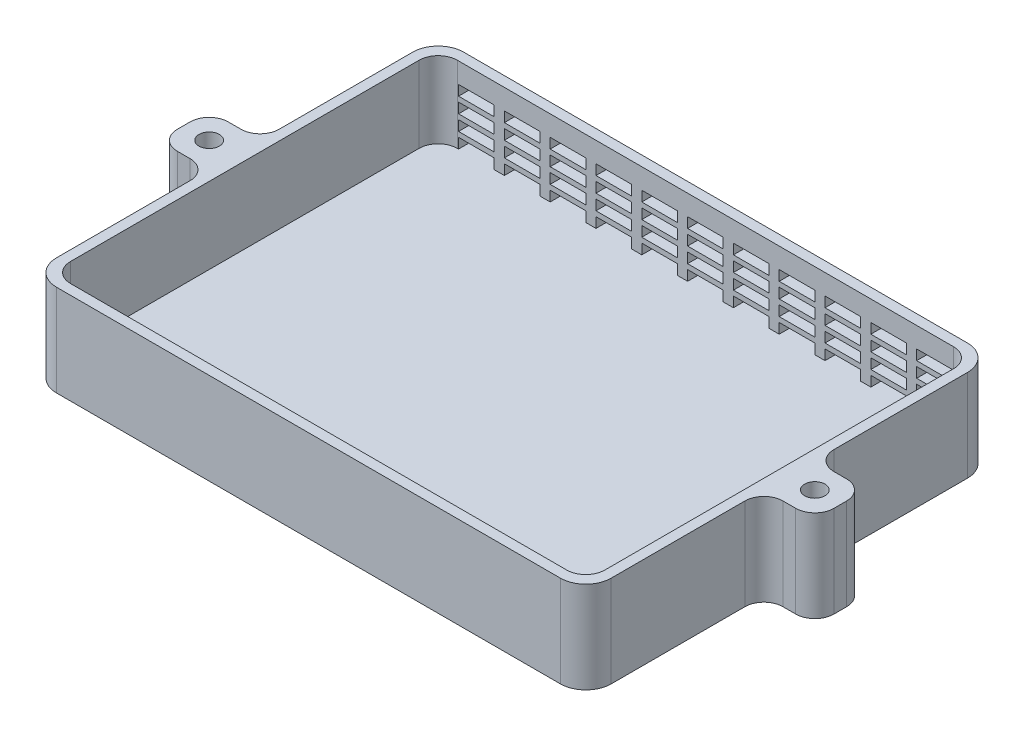
from build123d import *

# Parameters (mm, degrees)
SKETCH1_W           = 87.2
SKETCH1_H           = 64
BOSS_EXTRUDE1_DEPTH = 2.4
SKETCH2_W           = 87.2
SKETCH2_H           = 64
SKETCH2_W_2         = 84
SKETCH2_H_2         = 60.8
BOSS_EXTRUDE2_DEPTH = 12
SKETCH4_W           = 5.6
SKETCH4_H           = 1.6
CUT_EXTRUDE1_DEPTH  = 12
SKETCH7_W           = 8
SKETCH7_H           = 8
SKETCH7_R           = 1.6
BOSS_EXTRUDE4_DEPTH = 14.4
FILLET3_R           = 3
FILLET4_R           = 4
FILLET8_R           = 3
FILLET9_SIZE        = 1.6


with BuildPart() as part:
    # Sketch1 → Boss-Extrude1 (new body)
    with BuildSketch(Plane(origin=(0, 0, 0), x_dir=(1, 0, 0), z_dir=(0, 1, 0))):
        with Locations((43.6, -32)):
            Rectangle(SKETCH1_W, SKETCH1_H)
    extrude(amount=BOSS_EXTRUDE1_DEPTH)

    # Sketch2 → Boss-Extrude2 (add)
    with BuildSketch(Plane(origin=(0, 2.4, 0), x_dir=(1, 0, 0), z_dir=(0, 1, 0))):
        with Locations((43.6, -32)):
            Rectangle(SKETCH2_W, SKETCH2_H)
        with Locations((43.6, -32)):
            Rectangle(SKETCH2_W_2, SKETCH2_H_2, mode=Mode.SUBTRACT)
    extrude(amount=BOSS_EXTRUDE2_DEPTH)

    # Sketch4 → Cut-Extrude1 (cut)
    with BuildSketch(Plane(origin=(0, 0, 0), x_dir=(-1, 0, 0), z_dir=(0, 0, -1))):
        with Locations((-7.6, 3.2)):
            Rectangle(SKETCH4_W, SKETCH4_H)
        with Locations((-14.8, 3.2)):
            Rectangle(SKETCH4_W, SKETCH4_H)
        with Locations((-22, 3.2)):
            Rectangle(SKETCH4_W, SKETCH4_H)
        with Locations((-29.2, 3.2)):
            Rectangle(SKETCH4_W, SKETCH4_H)
        with Locations((-36.4, 3.2)):
            Rectangle(SKETCH4_W, SKETCH4_H)
        with Locations((-43.6, 3.2)):
            Rectangle(SKETCH4_W, SKETCH4_H)
        with Locations((-50.8, 3.2)):
            Rectangle(SKETCH4_W, SKETCH4_H)
        with Locations((-58, 3.2)):
            Rectangle(SKETCH4_W, SKETCH4_H)
        with Locations((-14.8, 5.6)):
            Rectangle(SKETCH4_W, SKETCH4_H)
        with Locations((-22, 5.6)):
            Rectangle(SKETCH4_W, SKETCH4_H)
        with Locations((-29.2, 5.6)):
            Rectangle(SKETCH4_W, SKETCH4_H)
        with Locations((-36.4, 5.6)):
            Rectangle(SKETCH4_W, SKETCH4_H)
        with Locations((-43.6, 5.6)):
            Rectangle(SKETCH4_W, SKETCH4_H)
        with Locations((-50.8, 5.6)):
            Rectangle(SKETCH4_W, SKETCH4_H)
        with Locations((-58, 5.6)):
            Rectangle(SKETCH4_W, SKETCH4_H)
        with Locations((-14.8, 8)):
            Rectangle(SKETCH4_W, SKETCH4_H)
        with Locations((-22, 8)):
            Rectangle(SKETCH4_W, SKETCH4_H)
        with Locations((-29.2, 8)):
            Rectangle(SKETCH4_W, SKETCH4_H)
        with Locations((-36.4, 8)):
            Rectangle(SKETCH4_W, SKETCH4_H)
        with Locations((-43.6, 8)):
            Rectangle(SKETCH4_W, SKETCH4_H)
        with Locations((-50.8, 8)):
            Rectangle(SKETCH4_W, SKETCH4_H)
        with Locations((-58, 8)):
            Rectangle(SKETCH4_W, SKETCH4_H)
        with Locations((-7.6, 5.6)):
            Rectangle(SKETCH4_W, SKETCH4_H)
        with Locations((-7.6, 8)):
            Rectangle(SKETCH4_W, SKETCH4_H)
        with Locations((-7.6, 10.4)):
            Rectangle(SKETCH4_W, SKETCH4_H)
        with Locations((-14.8, 10.4)):
            Rectangle(SKETCH4_W, SKETCH4_H)
        with Locations((-22, 10.4)):
            Rectangle(SKETCH4_W, SKETCH4_H)
        with Locations((-29.2, 10.4)):
            Rectangle(SKETCH4_W, SKETCH4_H)
        with Locations((-36.4, 10.4)):
            Rectangle(SKETCH4_W, SKETCH4_H)
        with Locations((-43.6, 10.4)):
            Rectangle(SKETCH4_W, SKETCH4_H)
        with Locations((-50.8, 10.4)):
            Rectangle(SKETCH4_W, SKETCH4_H)
        with Locations((-58, 10.4)):
            Rectangle(SKETCH4_W, SKETCH4_H)
        with Locations((-65.2, 3.2)):
            Rectangle(SKETCH4_W, SKETCH4_H)
        with Locations((-72.4, 3.2)):
            Rectangle(SKETCH4_W, SKETCH4_H)
        with Locations((-79.6, 3.2)):
            Rectangle(SKETCH4_W, SKETCH4_H)
        with Locations((-65.2, 5.6)):
            Rectangle(SKETCH4_W, SKETCH4_H)
        with Locations((-72.4, 5.6)):
            Rectangle(SKETCH4_W, SKETCH4_H)
        with Locations((-79.6, 5.6)):
            Rectangle(SKETCH4_W, SKETCH4_H)
        with Locations((-65.2, 8)):
            Rectangle(SKETCH4_W, SKETCH4_H)
        with Locations((-72.4, 8)):
            Rectangle(SKETCH4_W, SKETCH4_H)
        with Locations((-79.6, 8)):
            Rectangle(SKETCH4_W, SKETCH4_H)
        with Locations((-65.2, 10.4)):
            Rectangle(SKETCH4_W, SKETCH4_H)
        with Locations((-72.4, 10.4)):
            Rectangle(SKETCH4_W, SKETCH4_H)
        with Locations((-79.6, 10.4)):
            Rectangle(SKETCH4_W, SKETCH4_H)
    extrude(amount=-CUT_EXTRUDE1_DEPTH, mode=Mode.SUBTRACT)

    # Sketch7 → Boss-Extrude4 (add)
    # profile 1 of 2: a face of its own
    with BuildSketch(Plane(origin=(0, 14.4, 0), x_dir=(1, 0, 0), z_dir=(0, 1, 0))):
        with Locations((91.2, -32)):
            Rectangle(SKETCH7_W, SKETCH7_H)
        with Locations(Location((91.2, -32, 0), (0, 0, 270))):
            Circle(SKETCH7_R, mode=Mode.SUBTRACT)
    # profile 2 of 2: a face of its own
    with BuildSketch(Plane(origin=(0, 14.4, 0), x_dir=(1, 0, 0), z_dir=(0, 1, 0))):
        with Locations((-4, -32)):
            Rectangle(SKETCH7_W, SKETCH7_H)
        with Locations(Location((-4, -32, 0), (0, 0, 90))):
            Circle(SKETCH7_R, mode=Mode.SUBTRACT)
    extrude(amount=-BOSS_EXTRUDE4_DEPTH)

    # Fillet3
    fillet3_edges = [part.edges().sort_by_distance(p)[0] for p in [
        (85.6, 8.4, 62.4),
        (85.6, 8.4, 1.6),
        (1.6, 8.4, 1.6),
        (1.6, 8.4, 62.4),
    ]]
    fillet(fillet3_edges, radius=FILLET3_R)

    # Fillet4
    fillet4_edges = [part.edges().sort_by_distance(p)[0] for p in [
        (0, 7.2, 0),
        (87.2, 7.2, 0),
        (87.2, 7.2, 64),
        (0, 7.2, 64),
    ]]
    fillet(fillet4_edges, radius=FILLET4_R)

    # Fillet8
    fillet8_edges = [part.edges().sort_by_distance(p)[0] for p in [
        (87.2, 7.2, 36),
        (87.2, 7.2, 28),
        (95.2, 7.2, 28),
        (95.2, 7.2, 36),
        (0, 7.2, 36),
        (-8, 7.2, 36),
        (-8, 7.2, 28),
        (0, 7.2, 28),
    ]]
    fillet(fillet8_edges, radius=FILLET8_R)

    # Fillet9
    # a fillet whose section is not a circle: 1.6 mm, written as the material it takes off along each edge
    with BuildSketch(Plane(origin=(91.2, 0, 32), x_dir=(0, 0, 1), z_dir=(-1, 0, 0))) as fillet9_piece_1:
        with BuildLine():
            Bezier((1.6, FILLET9_SIZE), (1.6, 0), (1.6 + FILLET9_SIZE, 0), weights=[1, 0.052631579, 1])
            Line((1.6 + FILLET9_SIZE, 0), (1.6, 0))
            Line((1.6, 0), (1.6, FILLET9_SIZE))
        make_face()
    revolve(axis=Axis((91.2, 0, 32), (0, 1, 0)), mode=Mode.SUBTRACT)
    with BuildSketch(Plane(origin=(-4, 0, 32), x_dir=(0, 0, -1), z_dir=(1, 0, 0))) as fillet9_piece_2:
        with BuildLine():
            Bezier((1.6, FILLET9_SIZE), (1.6, 0), (1.6 + FILLET9_SIZE, 0), weights=[1, 0.052631579, 1])
            Line((1.6 + FILLET9_SIZE, 0), (1.6, 0))
            Line((1.6, 0), (1.6, FILLET9_SIZE))
        make_face()
    revolve(axis=Axis((-4, 0, 32), (0, 1, 0)), mode=Mode.SUBTRACT)


solid = part.part
